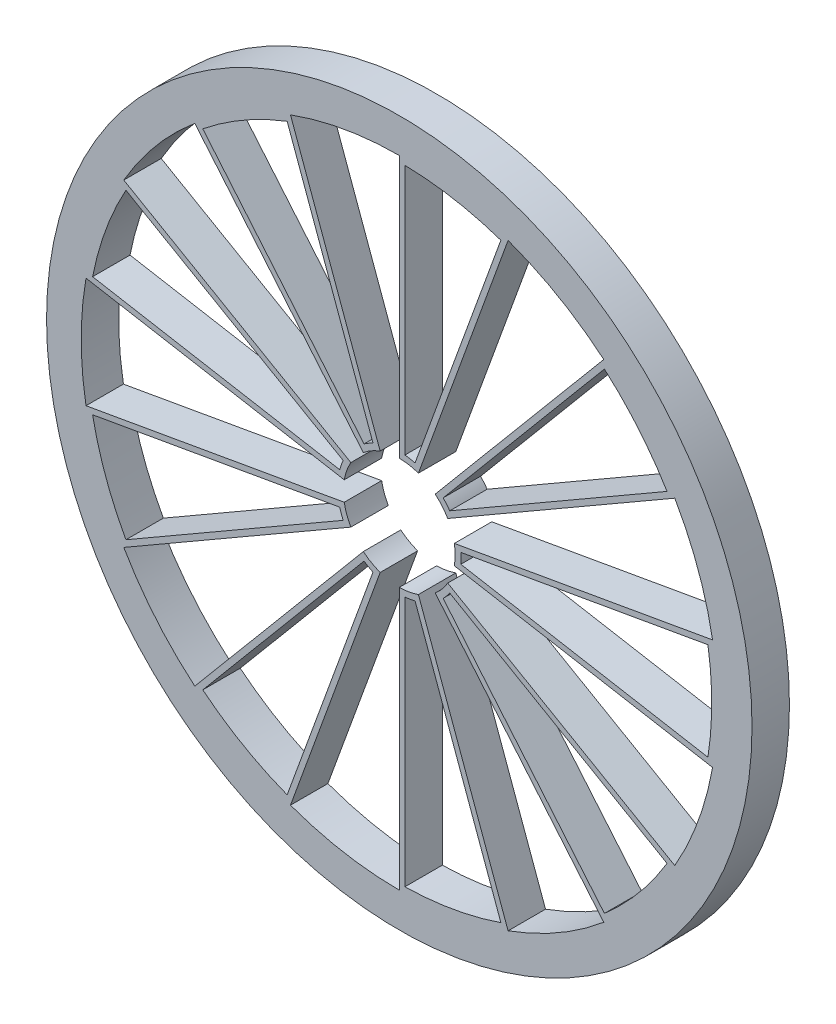
from build123d import *

# Parameters (mm, degrees)
SKETCH2_R           = 18.85
BOSS_EXTRUDE1_DEPTH = 2


with BuildPart() as part:
    # Sketch2 → Boss-Extrude1 (new body)
    with BuildSketch(Plane.XY.offset(10)):
        Circle(SKETCH2_R)
        with BuildLine():
            ThreePointArc((0, 2.988310559), (0.518914683, 2.942911407), (1.022062406, 2.808093381))
            Line((1.022062406, 2.808093381), (5.814342437, 15.974774553))
            ThreePointArc((5.814342437, 15.974774553), (8.5, 14.722431864), (10.927389365, 13.022755533))
            Line((10.927389365, 13.022755533), (1.920849002, 2.289178698))
            ThreePointArc((1.920849002, 2.289178698), (2.289178698, 1.920849002), (2.587952859, 1.49415528))
            Line((2.587952859, 1.49415528), (14.722431864, 8.5))
            ThreePointArc((14.722431864, 8.5), (15.974774553, 5.814342437), (16.741731801, 2.95201902))
            Line((16.741731801, 2.95201902), (2.942911407, 0.518914683))
            ThreePointArc((2.942911407, 0.518914683), (2.988310559, 0), (2.942911407, -0.518914683))
            Line((2.942911407, -0.518914683), (16.741731801, -2.95201902))
            ThreePointArc((16.741731801, -2.95201902), (15.974774553, -5.814342437), (14.722431864, -8.5))
            Line((14.722431864, -8.5), (2.587952859, -1.49415528))
            ThreePointArc((2.587952859, -1.49415528), (2.289178698, -1.920849002), (1.920849002, -2.289178698))
            Line((1.920849002, -2.289178698), (10.927389365, -13.022755533))
            ThreePointArc((10.927389365, -13.022755533), (8.5, -14.722431864), (5.814342437, -15.974774553))
            Line((5.814342437, -15.974774553), (1.022062406, -2.808093381))
            ThreePointArc((1.022062406, -2.808093381), (0.518914683, -2.942911407), (0, -2.988310559))
            Line((0, -2.988310559), (0, -17))
            ThreePointArc((0, -17), (-2.95201902, -16.741731801), (-5.814342437, -15.974774553))
            Line((-5.814342437, -15.974774553), (-1.022062406, -2.808093381))
            ThreePointArc((-1.022062406, -2.808093381), (-1.49415528, -2.587952859), (-1.920849002, -2.289178698))
            Line((-1.920849002, -2.289178698), (-10.927389365, -13.022755533))
            ThreePointArc((-10.927389365, -13.022755533), (-13.022755533, -10.927389365), (-14.722431864, -8.5))
            Line((-14.722431864, -8.5), (-2.587952859, -1.49415528))
            ThreePointArc((-2.587952859, -1.49415528), (-2.808093381, -1.022062406), (-2.942911407, -0.518914683))
            Line((-2.942911407, -0.518914683), (-16.741731801, -2.95201902))
            ThreePointArc((-16.741731801, -2.95201902), (-17, 0), (-16.741731801, 2.95201902))
            Line((-16.741731801, 2.95201902), (-2.942911407, 0.518914683))
            ThreePointArc((-2.942911407, 0.518914683), (-2.808093381, 1.022062406), (-2.587952859, 1.49415528))
            Line((-2.587952859, 1.49415528), (-14.722431864, 8.5))
            ThreePointArc((-14.722431864, 8.5), (-13.022755533, 10.927389365), (-10.927389365, 13.022755533))
            Line((-10.927389365, 13.022755533), (-1.920849002, 2.289178698))
            ThreePointArc((-1.920849002, 2.289178698), (-1.49415528, 2.587952859), (-1.022062406, 2.808093381))
            Line((-1.022062406, 2.808093381), (-5.814342437, 15.974774553))
            ThreePointArc((-5.814342437, 15.974774553), (-2.95201902, 16.741731801), (0, 17))
            Line((0, 17), (0, 2.988310559))
        make_face(mode=Mode.SUBTRACT)
        with BuildLine():
            ThreePointArc((0.842085099, 3.190751116), (0.573038986, 3.249865585), (0.3, 3.286335345))
            Line((0.3, 3.286335345), (0.3, 16.694842323))
            ThreePointArc((0.3, 16.694842323), (2.899496967, 16.443864434), (5.428064578, 15.790626179))
            Line((5.428064578, 15.790626179), (0.842085099, 3.190751116))
        make_face(mode=Mode.SUBTRACT)
        with BuildLine():
            ThreePointArc((-10.501424458, 12.981827473), (-8.348768774, 14.460491698), (-5.99188015, 15.585414093))
            Line((-5.99188015, 15.585414093), (-1.405900672, 2.98553903))
            ThreePointArc((-1.405900672, 2.98553903), (-1.65, 2.857883832), (-1.882602308, 2.710315212))
            Line((-1.882602308, 2.710315212), (-10.501424458, 12.981827473))
        make_face(mode=Mode.SUBTRACT)
        with BuildLine():
            ThreePointArc((-16.389115702, 3.194471272), (-15.69055282, 5.710894186), (-14.608157564, 8.08761354))
            Line((-14.608157564, 8.08761354), (-2.996049894, 1.383360051))
            ThreePointArc((-2.996049894, 1.383360051), (-3.100985649, 1.128666473), (-3.184314073, 0.86610847))
            Line((-3.184314073, 0.86610847), (-16.389115702, 3.194471272))
        make_face(mode=Mode.SUBTRACT)
        with BuildLine():
            ThreePointArc((-14.608157564, -8.08761354), (-15.69055282, -5.710894186), (-16.389115702, -3.194471272))
            Line((-16.389115702, -3.194471272), (-3.184314073, -0.86610847))
            ThreePointArc((-3.184314073, -0.86610847), (-3.100985649, -1.128666473), (-2.996049894, -1.383360051))
            Line((-2.996049894, -1.383360051), (-14.608157564, -8.08761354))
        make_face(mode=Mode.SUBTRACT)
        with BuildLine():
            ThreePointArc((-5.99188015, -15.585414093), (-8.348768774, -14.460491698), (-10.501424458, -12.981827473))
            Line((-10.501424458, -12.981827473), (-1.882602308, -2.710315212))
            ThreePointArc((-1.882602308, -2.710315212), (-1.65, -2.857883832), (-1.405900672, -2.98553903))
            Line((-1.405900672, -2.98553903), (-5.99188015, -15.585414093))
        make_face(mode=Mode.SUBTRACT)
        with BuildLine():
            ThreePointArc((5.428064578, -15.790626179), (2.899496967, -16.443864434), (0.3, -16.694842323))
            Line((0.3, -16.694842323), (0.3, -3.286335345))
            ThreePointArc((0.3, -3.286335345), (0.573038986, -3.249865585), (0.842085099, -3.190751116))
            Line((0.842085099, -3.190751116), (5.428064578, -15.790626179))
        make_face(mode=Mode.SUBTRACT)
        with BuildLine():
            ThreePointArc((14.308157564, -8.607228783), (12.791055853, -10.732970249), (10.961051124, -12.596154907))
            Line((10.961051124, -12.596154907), (2.342228974, -2.324642646))
            ThreePointArc((2.342228974, -2.324642646), (2.527946662, -2.121199112), (2.696049894, -1.902975294))
            Line((2.696049894, -1.902975294), (14.308157564, -8.607228783))
        make_face(mode=Mode.SUBTRACT)
        with BuildLine():
            ThreePointArc((16.493304608, 2.60358662), (16.697537549, 0), (16.493304608, -2.60358662))
            Line((16.493304608, -2.60358662), (3.28850298, -0.275223818))
            ThreePointArc((3.28850298, -0.275223818), (3.3, 0), (3.28850298, 0.275223818))
            Line((3.28850298, 0.275223818), (16.493304608, 2.60358662))
        make_face(mode=Mode.SUBTRACT)
        with BuildLine():
            ThreePointArc((10.961051124, 12.596154907), (12.791055853, 10.732970249), (14.308157564, 8.607228783))
            Line((14.308157564, 8.607228783), (2.696049894, 1.902975294))
            ThreePointArc((2.696049894, 1.902975294), (2.527946662, 2.121199112), (2.342228974, 2.324642646))
            Line((2.342228974, 2.324642646), (10.961051124, 12.596154907))
        make_face(mode=Mode.SUBTRACT)
    extrude(amount=-BOSS_EXTRUDE1_DEPTH)


solid = part.part
